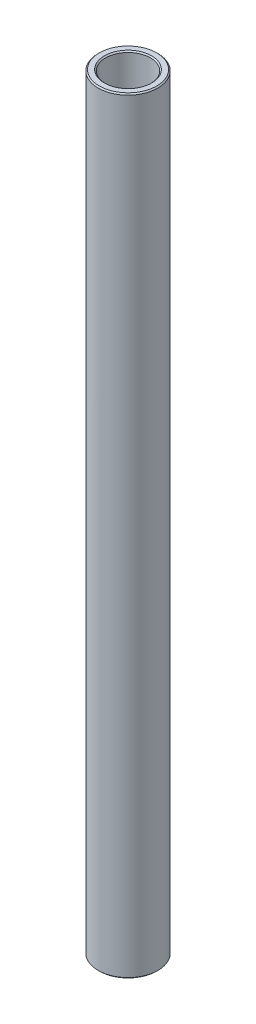
from build123d import *

# Parameters (mm, degrees)
SKETCH1_W     = 1.5875
SKETCH1_H     = 162.848779076
CHAMFER1_SIZE = 0.254


with BuildPart() as part:
    # Sketch1 → Revolve1 (revolve)
    with BuildSketch(Plane.XY):
        with Locations((5.55625, 90.949389538)):
            Rectangle(SKETCH1_W, SKETCH1_H)
    revolve(axis=Axis((0, 0, 0), (3.0834225336792653e-12, 1.0, 0)))

    # Chamfer1
    chamfer1_edges = [part.edges().sort_by_distance(p)[0] for p in [
        (-6.349999999, 172.373779076, 0),
        (-4.762499999, 172.373779076, 0),
        (-4.7625, 9.525, 0),
        (-6.35, 9.525, 0),
    ]]
    chamfer(chamfer1_edges, length=CHAMFER1_SIZE)


solid = part.part
